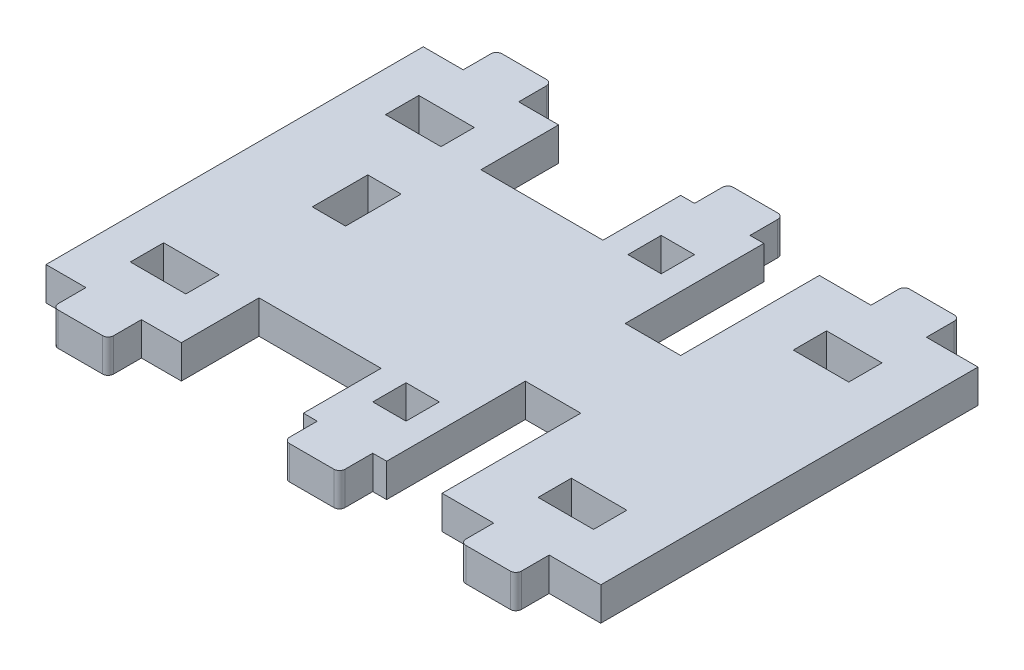
from build123d import *

# Parameters (mm, degrees)
SKETCH1_W                                   = 100
SKETCH1_H                                   = 68
BOSS_EXTRUDE1_DEPTH                         = 6
SKETCH2_W                                   = 10
SKETCH2_H                                   = 25
CUT_EXTRUDE1_DEPTH                          = 61.761830124
SKETCH3_W                                   = 22
SKETCH3_H                                   = 14
CUT_EXTRUDE2_DEPTH                          = 61.761830124
SKETCH234_W                                 = 10
SKETCH234_H                                 = 6
BOSS_EXTRUDE234_DEPTH                       = 6
FILLET134_R                                 = 1
SKETCH2341_W                                = 10
SKETCH2341_H                                = 6
BOSS_EXTRUDE2341_DEPTH                      = 6
FILLET1341_R                                = 1
SKETCH2342_W                                = 10
SKETCH2342_H                                = 6
BOSS_EXTRUDE2342_DEPTH                      = 6
FILLET1342_R                                = 1
SKETCH6_W                                   = 10
SKETCH6_H                                   = 6
CUT_EXTRUDE11_DEPTH                         = 105.61109994
SKETCH62_W                                  = 10
SKETCH62_H                                  = 6
CUT_EXTRUDE13_DEPTH                         = 108.583694896
CUT_EXTRUDE110_START                        = -3
SKETCH67_W                                  = 6
SKETCH67_H                                  = 6
CUT_EXTRUDE110_DEPTH                        = 6
FILLET134_OF_MIRROR2_R                      = 1
FILLET1341_OF_MIRROR2_R                     = 1
FILLET1342_OF_MIRROR2_R                     = 1
SMART_FEATURE3_VIRTUAL_PIN_51_START         = 34
SMART_FEATURE3_VIRTUAL_PIN_51_OUTLINE_W     = 10
SMART_FEATURE3_VIRTUAL_PIN_51_OUTLINE_H     = 6
SMART_FEATURE3_VIRTUAL_PIN_51_DEPTH         = 6
SMART_FEATURE3_VIRTUAL_PIN_51_START_2       = 20
SMART_FEATURE3_VIRTUAL_PIN_51_2_OUTLINE_W   = 10
SMART_FEATURE3_VIRTUAL_PIN_51_2_OUTLINE_H   = 6
SMART_FEATURE3_VIRTUAL_PIN_51_2_OUTLINE_W_2 = 6
SMART_FEATURE3_VIRTUAL_PIN_51_2_DEPTH       = 6
CUT_EXTRUDE16_START                         = -3
CUT_EXTRUDE16_OUTLINE_W                     = 6
CUT_EXTRUDE16_OUTLINE_H                     = 10
CUT_EXTRUDE16_OUTLINE_H_2                   = 6
CUT_EXTRUDE16_OUTLINE_W_2                   = 10
CUT_EXTRUDE16_DEPTH                         = 6
CUT_EXTRUDE16_2_DEPTH                       = 6


# Read off the part's stored shape, not the designer's step: Smart-Feature3<virtual_pin-51>, Cut-Extrude16
with BuildPart() as part:
    # Sketch1 → Boss-Extrude1 (new body)
    with BuildSketch(Plane(origin=(0, 0, 0), x_dir=(1, 0, 0), z_dir=(0, 1, 0))):
        Rectangle(SKETCH1_W, SKETCH1_H)
    extrude(amount=BOSS_EXTRUDE1_DEPTH)

    # Sketch2 → Cut-Extrude1 (cut, through all)
    with BuildSketch(Plane.XZ):
        with Locations((16.4, -21.5)):
            Rectangle(SKETCH2_W, SKETCH2_H)
    cut_extrude1 = extrude(amount=-CUT_EXTRUDE1_DEPTH, mode=Mode.SUBTRACT)

    # Sketch3 → Cut-Extrude2 (cut, through all)
    with BuildSketch(Plane.XZ):
        with Locations((-14.6, -27)):
            Rectangle(SKETCH3_W, SKETCH3_H)
    cut_extrude2 = extrude(amount=-CUT_EXTRUDE2_DEPTH, mode=Mode.SUBTRACT)

    # Mirror1: Cut-Extrude1, Cut-Extrude2 across plane
    add(cut_extrude1.mirror(Plane.XY), mode=Mode.SUBTRACT)
    add(cut_extrude2.mirror(Plane.XY), mode=Mode.SUBTRACT)

    # Sketch234 → Boss-Extrude234 (add)
    with BuildSketch(Plane(origin=(34.932221392, 6, -34), x_dir=(1, 0, 0), z_dir=(0, 0, -1))):
        with Locations((0.767778608, 3)):
            Rectangle(SKETCH234_W, SKETCH234_H)
    boss_extrude234 = extrude(amount=BOSS_EXTRUDE234_DEPTH)

    # Fillet134
    fillet134_edges = [part.edges().sort_by_distance(p)[0] for p in [
        (40.7, 3, -40),
        (30.7, 3, -40),
    ]]
    fillet(fillet134_edges, radius=FILLET134_R)

    # Sketch2341 → Boss-Extrude2341 (add)
    with BuildSketch(Plane(origin=(3.132221392, 6, -34), x_dir=(1, 0, 0), z_dir=(0, 0, -1))):
        with Locations((0.767778608, 3)):
            Rectangle(SKETCH2341_W, SKETCH2341_H)
    boss_extrude2341 = extrude(amount=BOSS_EXTRUDE2341_DEPTH)

    # Fillet1341
    fillet1341_edges = [part.edges().sort_by_distance(p)[0] for p in [
        (8.9, 3, -40),
        (-1.1, 3, -40),
    ]]
    fillet(fillet1341_edges, radius=FILLET1341_R)

    # Sketch2342 → Boss-Extrude2342 (add)
    with BuildSketch(Plane(origin=(-38.567778608, 6, -34), x_dir=(1, 0, 0), z_dir=(0, 0, -1))):
        with Locations((0.767778608, 3)):
            Rectangle(SKETCH2342_W, SKETCH2342_H)
    boss_extrude2342 = extrude(amount=BOSS_EXTRUDE2342_DEPTH)

    # Fillet1342
    fillet1342_edges = [part.edges().sort_by_distance(p)[0] for p in [
        (-32.8, 3, -40),
        (-42.8, 3, -40),
    ]]
    fillet(fillet1342_edges, radius=FILLET1342_R)

    # Sketch6 → Cut-Extrude11 (cut, symmetric)
    with BuildSketch(Plane(origin=(34.932221392, 3, 21), x_dir=(1, 0, 0), z_dir=(0, -1, 0))):
        with Locations((0.767778608, -44)):
            Rectangle(SKETCH6_W, SKETCH6_H)
    cut_extrude11 = extrude(amount=CUT_EXTRUDE11_DEPTH, both=True, mode=Mode.SUBTRACT)

    # Sketch62 → Cut-Extrude13 (cut, symmetric)
    with BuildSketch(Plane(origin=(-38.567778608, 3, 21), x_dir=(1, 0, 0), z_dir=(0, -1, 0))):
        with Locations((0.767778608, -44)):
            Rectangle(SKETCH62_W, SKETCH62_H)
    cut_extrude13 = extrude(amount=CUT_EXTRUDE13_DEPTH, both=True, mode=Mode.SUBTRACT)

    # Sketch67 → Cut-Extrude110 (cut)
    with BuildSketch(Plane(origin=(3.132221392, 3, 21), x_dir=(1, 0, 0), z_dir=(0, -1, 0)).offset(CUT_EXTRUDE110_START)):
        with Locations((0.767778608, -44)):
            Rectangle(SKETCH67_W, SKETCH67_H)
    cut_extrude110 = extrude(amount=CUT_EXTRUDE110_DEPTH, mode=Mode.SUBTRACT)

    # Mirror2: Boss-Extrude234, Boss-Extrude2341, Boss-Extrude2342, Cut-Extrude11, Cut-Extrude13, Cut-Extrude110 across plane
    add(boss_extrude234.mirror(Plane.XY))
    add(boss_extrude2341.mirror(Plane.XY))
    add(boss_extrude2342.mirror(Plane.XY))
    add(cut_extrude11.mirror(Plane.XY), mode=Mode.SUBTRACT)
    add(cut_extrude13.mirror(Plane.XY), mode=Mode.SUBTRACT)
    add(cut_extrude110.mirror(Plane.XY), mode=Mode.SUBTRACT)

    # Fillet134 of Mirror2
    fillet134_of_mirror2_edges = [part.edges().sort_by_distance(p)[0] for p in [
        (40.7, 3, 40),
        (30.7, 3, 40),
    ]]
    fillet(fillet134_of_mirror2_edges, radius=FILLET134_OF_MIRROR2_R)

    # Fillet1341 of Mirror2
    fillet1341_of_mirror2_edges = [part.edges().sort_by_distance(p)[0] for p in [
        (8.9, 3, 40),
        (-1.1, 3, 40),
    ]]
    fillet(fillet1341_of_mirror2_edges, radius=FILLET1341_OF_MIRROR2_R)

    # Fillet1342 of Mirror2
    fillet1342_of_mirror2_edges = [part.edges().sort_by_distance(p)[0] for p in [
        (-32.8, 3, 40),
        (-42.8, 3, 40),
    ]]
    fillet(fillet1342_of_mirror2_edges, radius=FILLET1342_OF_MIRROR2_R)

    # Smart-Feature3<virtual_pin-51> outline → Smart-Feature3<virtual_pin-51> (cut)
    with BuildSketch(Plane.XY.offset(SMART_FEATURE3_VIRTUAL_PIN_51_START)):
        with Locations((35.7, 3)):
            Rectangle(SMART_FEATURE3_VIRTUAL_PIN_51_OUTLINE_W, SMART_FEATURE3_VIRTUAL_PIN_51_OUTLINE_H)
        with Locations((3.9, 3)):
            Rectangle(SMART_FEATURE3_VIRTUAL_PIN_51_OUTLINE_W, SMART_FEATURE3_VIRTUAL_PIN_51_OUTLINE_H)
        with Locations((-37.8, 3)):
            Rectangle(SMART_FEATURE3_VIRTUAL_PIN_51_OUTLINE_W, SMART_FEATURE3_VIRTUAL_PIN_51_OUTLINE_H)
    extrude(amount=SMART_FEATURE3_VIRTUAL_PIN_51_DEPTH, mode=Mode.SUBTRACT)

    # Smart-Feature3_virtual_pin-51 2 outline → Smart-Feature3_virtual_pin-51 2 (add)
    with BuildSketch(Plane.XY.offset(SMART_FEATURE3_VIRTUAL_PIN_51_START_2)):
        with Locations((35.7, 3)):
            Rectangle(SMART_FEATURE3_VIRTUAL_PIN_51_2_OUTLINE_W, SMART_FEATURE3_VIRTUAL_PIN_51_2_OUTLINE_H)
        with Locations((3.9, 3)):
            Rectangle(SMART_FEATURE3_VIRTUAL_PIN_51_2_OUTLINE_W_2, SMART_FEATURE3_VIRTUAL_PIN_51_2_OUTLINE_H)
        with Locations((-37.8, 3)):
            Rectangle(SMART_FEATURE3_VIRTUAL_PIN_51_2_OUTLINE_W, SMART_FEATURE3_VIRTUAL_PIN_51_2_OUTLINE_H)
    extrude(amount=SMART_FEATURE3_VIRTUAL_PIN_51_2_DEPTH)

    # Cut-Extrude16 outline → Cut-Extrude16 (cut)
    with BuildSketch(Plane(origin=(-76, 3, -3.232221392), x_dir=(0, 0, -1), z_dir=(0, 1, 0)).offset(CUT_EXTRUDE16_START)):
        with Locations((-26.232221392, -111.7)):
            Rectangle(CUT_EXTRUDE16_OUTLINE_W, CUT_EXTRUDE16_OUTLINE_H)
        with Locations((-26.232221392, -38.2)):
            Rectangle(CUT_EXTRUDE16_OUTLINE_W, CUT_EXTRUDE16_OUTLINE_H)
        with Locations((-26.232221392, -79.9)):
            Rectangle(CUT_EXTRUDE16_OUTLINE_W, CUT_EXTRUDE16_OUTLINE_H_2)
        with Locations((0.767778608, -44)):
            Rectangle(CUT_EXTRUDE16_OUTLINE_W_2, CUT_EXTRUDE16_OUTLINE_H_2)
    extrude(amount=CUT_EXTRUDE16_DEPTH, mode=Mode.SUBTRACT)

    # Cut-Extrude16 2 outline → Cut-Extrude16 2 (add)
    with BuildSketch(Plane(origin=(-76, 3, -3.232221392), x_dir=(0, 0, -1), z_dir=(0, 1, 0)).offset(CUT_EXTRUDE16_START)):
        with BuildLine():
            ThreePointArc((-43.232221392, -115.7), (-42.939328173, -116.407106781), (-42.232221392, -116.7))
            Line((-42.232221392, -116.7), (-37.232221392, -116.7))
            Line((-37.232221392, -116.7), (-37.232221392, -106.7))
            Line((-37.232221392, -106.7), (-42.232221392, -106.7))
            ThreePointArc((-42.232221392, -106.7), (-42.939328173, -106.992893219), (-43.232221392, -107.7))
            Line((-43.232221392, -107.7), (-43.232221392, -115.7))
        make_face()
        with BuildLine():
            ThreePointArc((-43.232221392, -83.9), (-42.939328173, -84.607106781), (-42.232221392, -84.9))
            Line((-42.232221392, -84.9), (-37.232221392, -84.9))
            Line((-37.232221392, -84.9), (-37.232221392, -74.9))
            Line((-37.232221392, -74.9), (-42.232221392, -74.9))
            ThreePointArc((-42.232221392, -74.9), (-42.939328173, -75.192893219), (-43.232221392, -75.9))
            Line((-43.232221392, -75.9), (-43.232221392, -83.9))
        make_face()
        with BuildLine():
            ThreePointArc((-43.232221392, -42.2), (-42.939328173, -42.907106781), (-42.232221392, -43.2))
            Line((-42.232221392, -43.2), (-37.232221392, -43.2))
            Line((-37.232221392, -43.2), (-37.232221392, -33.2))
            Line((-37.232221392, -33.2), (-42.232221392, -33.2))
            ThreePointArc((-42.232221392, -33.2), (-42.939328173, -33.492893219), (-43.232221392, -34.2))
            Line((-43.232221392, -34.2), (-43.232221392, -42.2))
        make_face()
    extrude(amount=CUT_EXTRUDE16_2_DEPTH)


solid = part.part
